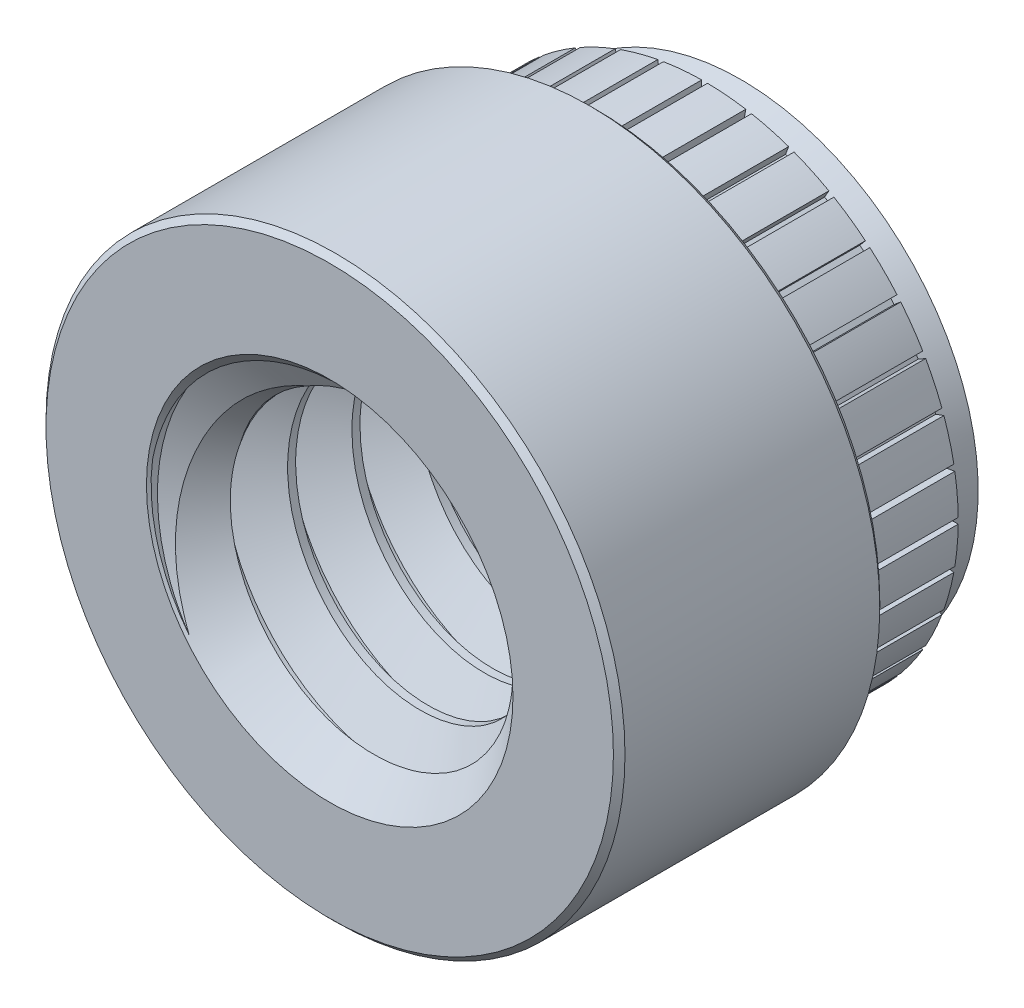
from build123d import *

# Parameters (mm, degrees)
SKETCH1_R               = 6.35
EXTRUDE1_DEPTH          = 5.842
SKETCH2_R               = 5.5626
EXTRUDE2_DEPTH          = 3.175
SKETCH3_W               = 0.127
SKETCH3_H               = 0.9779
CUT_EXTRUDE_THIN1_DEPTH = 3.175
CIRPATTERN1_COUNT       = 36
SKETCH5_OUTSIDE_W       = 19.298
SKETCH5_OUTSIDE_H       = 19.298
SKETCH5_OUTSIDE_R       = 5.207
CUT_EXTRUDE1_DEPTH      = 0.79375
CUT_EXTRUDE1_DRAFT      = 20
CHAMFER2_SIZE           = 0.127
SKETCH7_R               = 3.96875
CUT_EXTRUDE3_DEPTH      = 13.726008369
SWEEP1_PITCH            = 1.411111111
SKETCH10_R              = 6.35
CUT_EXTRUDE4_DEPTH      = 14.628879701
SKETCH11_R              = 5.207
CUT_EXTRUDE5_DEPTH      = 13.72600844


with BuildPart() as part:
    # Sketch1 → Extrude1 (new body)
    with BuildSketch(Plane.XY):
        Circle(SKETCH1_R)
    extrude(amount=-EXTRUDE1_DEPTH)

    # Sketch2 → Extrude2 (add)
    with BuildSketch(Plane(origin=(0, 0, -5.842), x_dir=(-1, 0, 0), z_dir=(0, 0, -1))):
        with Locations(Location((0, 0, 0), (0, 0, 180))):
            Circle(SKETCH2_R)
    extrude(amount=EXTRUDE2_DEPTH)

    # Sketch3 → Cut-Extrude-Thin1 (cut)
    with BuildSketch(Plane(origin=(0, 0, -9.017), x_dir=(-1, 0, 0), z_dir=(0, 0, -1))):
        with Locations((0, 5.86105)):
            Rectangle(SKETCH3_W, SKETCH3_H)
    cut_extrude_thin1 = extrude(amount=-CUT_EXTRUDE_THIN1_DEPTH, mode=Mode.SUBTRACT)

    # CirPattern1: Cut-Extrude-Thin1 ×36 about axis
    cirpattern1_axis = Axis((0, 0, 0), (0, 0, 1))
    for i in range(1, CIRPATTERN1_COUNT):
        add(cut_extrude_thin1.rotate(cirpattern1_axis, i * 360 / CIRPATTERN1_COUNT), mode=Mode.SUBTRACT)


with BuildPart() as cut_extrude1_tool:
    # Sketch5 outside → Cut-Extrude1 (with draft: the straight prism first)
    with BuildSketch(Plane(origin=(0, 0, -9.017), x_dir=(-1, 0, 0), z_dir=(0, 0, -1))):
        Rectangle(SKETCH5_OUTSIDE_W, SKETCH5_OUTSIDE_H)
        Circle(SKETCH5_OUTSIDE_R, mode=Mode.SUBTRACT)
    extrude(amount=-CUT_EXTRUDE1_DEPTH)
    # Cut-Extrude1: the draft: its side faces are tilted about the plane it starts from
    cut_extrude1_sides = [cut_extrude1_tool.faces().sort_by_distance(p)[0] for p in [
        (0, -9.649, -8.620125),
        (-9.649, 0, -8.620125),
        (0, 9.649, -8.620125),
        (9.649, 0, -8.620125),
        (5.207, 0, -8.620125),
    ]]
    draft(cut_extrude1_sides, Plane(origin=(0, 0, -9.017), x_dir=(-1, 0, 0), z_dir=(0, 0, -1)), CUT_EXTRUDE1_DRAFT)


with BuildPart() as part_1:
    add(part.part)

    # Cut-Extrude1: cut by cut_extrude1_tool
    add(cut_extrude1_tool.part, mode=Mode.SUBTRACT)

    # Chamfer2
    chamfer2_edges = [part_1.edges().sort_by_distance(p)[0] for p in [
        (-6.35, 0, 0),
        (-6.35, 0, -5.842),
    ]]
    chamfer(chamfer2_edges, length=CHAMFER2_SIZE)

    # Sketch7 → Cut-Extrude3 (cut, through all)
    with BuildSketch(Plane.XY):
        Circle(SKETCH7_R)
    extrude(amount=-CUT_EXTRUDE3_DEPTH, mode=Mode.SUBTRACT)

    # Sweep1: the profile of Sketch9 profile screwed along a right-hand helix of 8.64 turns, 6 arcs to a turn; built about Z, then put on its axis
    sweep1_z = Axis((0, 0, 0), (0, 0, 1))
    sweep1_corners = [(3.96905, 0, -1.234895427), (3.052206448, 0, -0.705555556), (3.052206448, 0, -0.529166667), (3.96905, 0, 0.000173205)]
    with BuildLine(mode=Mode.PRIVATE) as sweep1_profile:
        Line(sweep1_corners[0], sweep1_corners[1])
        Line(sweep1_corners[1], sweep1_corners[2])
        Line(sweep1_corners[2], sweep1_corners[3])
        Line(sweep1_corners[3], sweep1_corners[0])
    sweep1_cap = Face(sweep1_profile.wire())
    sweep1_turn_angles = [0, 30, 60, 90, 120, 150, 180, 210, 240, 270, 300, 330, 360]
    sweep1_turn_weights = [1, 0.8660254037844387, 1, 0.8660254037844387, 1, 0.8660254037844387, 1, 0.8660254037844387, 1, 0.8660254037844387, 1, 0.8660254037844387, 1]
    sweep1_turn_rails = [Edge.make_bspline([Vector(p[0], p[1], 0).rotate(sweep1_z, sweep1_turn_angles[k]) / sweep1_turn_weights[k] + Vector(0, 0, p[2] + SWEEP1_PITCH * sweep1_turn_angles[k] / 360) for k in range(13)], [0, 0, 0, 1, 1, 2, 2, 3, 3, 4, 4, 5, 5, 6, 6, 6], 2, sweep1_turn_weights) for p in sweep1_corners]
    sweep1_turn_sides = [Face.make_surface_from_curves(sweep1_turn_rails[p[0]], sweep1_turn_rails[p[1]]) for p in [(0, 1), (1, 2), (2, 3), (3, 0)]]
    sweep1_last_angles = [2880, 2910, 2940, 2970, 3000, 3030, 3060, 3085.2, 3110.4]
    sweep1_last_weights = [1, 0.8660254037844387, 1, 0.8660254037844387, 1, 0.8660254037844387, 1, 0.9048270524660581, 1]
    sweep1_last_rails = [Edge.make_bspline([Vector(p[0], p[1], 0).rotate(sweep1_z, sweep1_last_angles[k]) / sweep1_last_weights[k] + Vector(0, 0, p[2] + SWEEP1_PITCH * sweep1_last_angles[k] / 360) for k in range(9)], [0, 0, 0, 1, 1, 2, 2, 3, 3, 4, 4, 4], 2, sweep1_last_weights) for p in sweep1_corners]
    sweep1_last_sides = [Face.make_surface_from_curves(sweep1_last_rails[p[0]], sweep1_last_rails[p[1]]) for p in [(0, 1), (1, 2), (2, 3), (3, 0)]]
    sweep1 = Plane(origin=(0, 0, -9.017), x_dir=(0, 1, 0), z_dir=(0, 0, 1)) * Solid(Shell([*[p.moved(Location((0, 0, SWEEP1_PITCH * i))) for i in range(8) for p in sweep1_turn_sides], *sweep1_last_sides, sweep1_cap, sweep1_cap.rotate(sweep1_z, 3110.4).moved(Location((0, 0, SWEEP1_PITCH * 3110.4 / 360)))]))
    add(sweep1)

    # Sketch10 → Cut-Extrude4 (cut, through all)
    with BuildSketch(Plane.XY):
        Circle(SKETCH10_R)
    extrude(amount=CUT_EXTRUDE4_DEPTH, mode=Mode.SUBTRACT)

    # Sketch11 → Cut-Extrude5 (cut, through all)
    with BuildSketch(Plane(origin=(0, 0, -9.017), x_dir=(-1, 0, 0), z_dir=(0, 0, -1))):
        Circle(SKETCH11_R)
    extrude(amount=CUT_EXTRUDE5_DEPTH, mode=Mode.SUBTRACT)

    # Cut-Extrude6 cone 1 section (through the dimple's axis) → Cut-Extrude6 (revolve, cut)
    with BuildSketch(Plane(origin=(0, 0, 0), x_dir=(0, -1, 0), z_dir=(1, 0, 0))):
        Polygon((0, 0), (4.01955, 0), (0, 4.01955), align=None)
    revolve(axis=Axis((0, 0, 0), (0, 0, -1)), mode=Mode.SUBTRACT)

    # Cut-Extrude7 cone 1 section (through the dimple's axis) → Cut-Extrude7 (revolve, cut)
    with BuildSketch(Plane(origin=(0, 0, -9.017), x_dir=(0, 1, 0), z_dir=(1, 0, 0))):
        Polygon((0, 0), (4.01955, 0), (0, 4.01955), align=None)
    revolve(axis=Axis((0, 0, -9.017), (0, 0, 1)), mode=Mode.SUBTRACT)


solid = part_1.part
